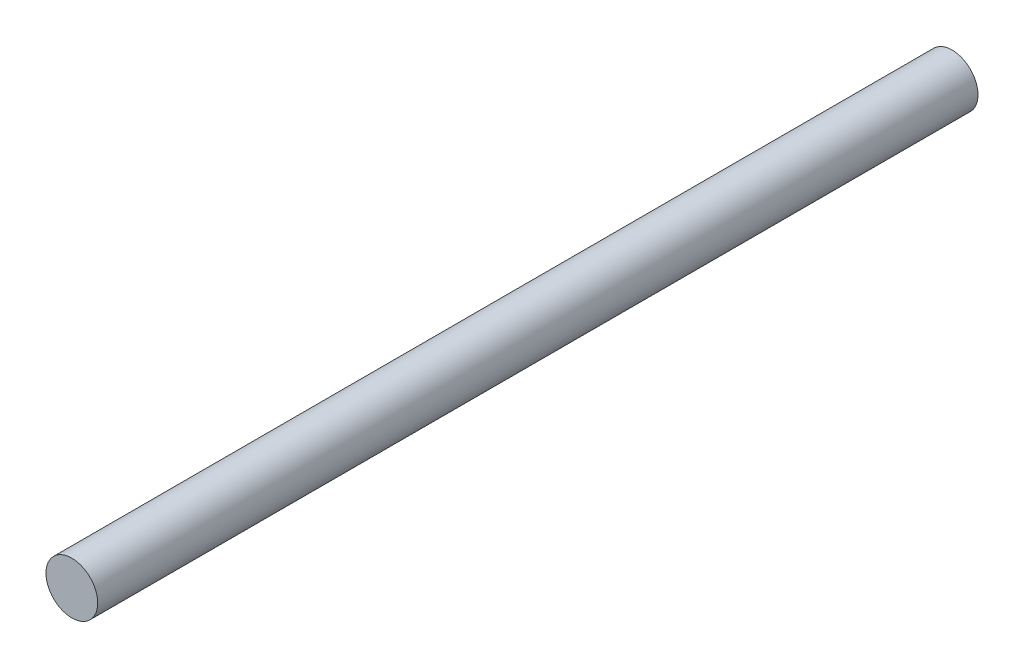
from build123d import *

# Parameters (mm, degrees)
SKETCH1_R           = 1
BOSS_EXTRUDE1_DEPTH = 34


with BuildPart() as part:
    # Sketch1 → Boss-Extrude1 (new body)
    with BuildSketch(Plane.XY):
        Circle(SKETCH1_R)
    extrude(amount=BOSS_EXTRUDE1_DEPTH)


solid = part.part
